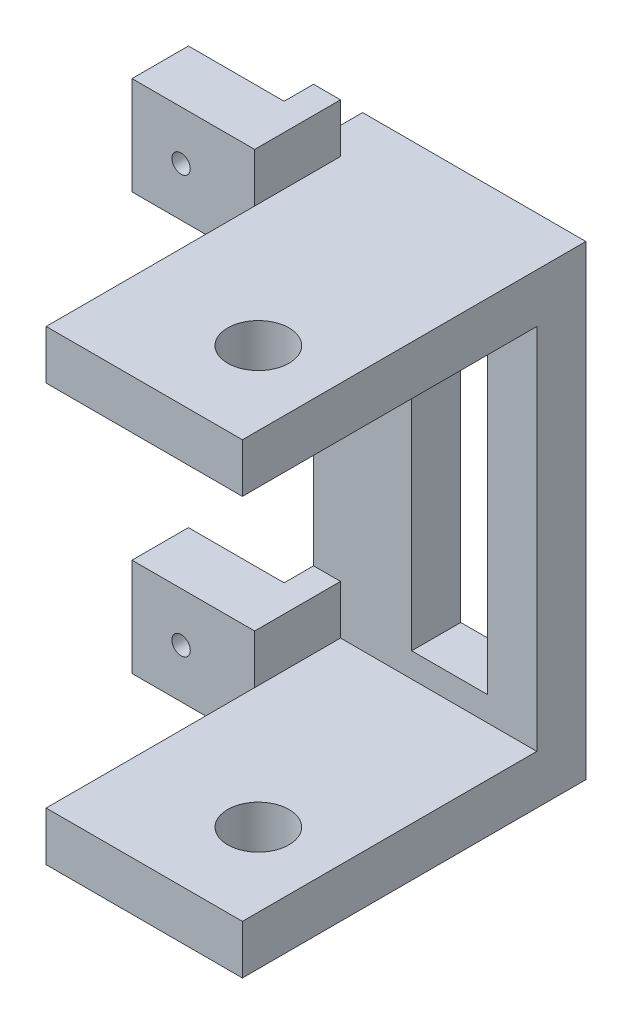
from build123d import *

# Parameters (mm, degrees)
SKETCH_2_W          = 12
SKETCH_2_H          = 19
SKETCH_2_W_2        = 3.1
SKETCH_2_H_2        = 13
EXTRUDE_1_DEPTH     = 2
SKETCH_3_W          = 8
SKETCH_3_H          = 2
EXTRUDE_2_DEPTH     = 12
SKETCH_10_W         = 5
SKETCH_10_H         = 4
EXTRUDE_4_DEPTH     = 3.5
CUT_EXTRUDE_2_REACH = 23.496
CUT_EXTRUDE_START   = 3.5
SKETCH_9_R          = 0.375
SKETCH_11_R         = 1.25
CUT_EXTRUDE_3_DEPTH = 27.165053029
CUT_EXTRUDE_4_REACH = 28.165
SKETCH_12_W         = 3.9
SKETCH_12_H         = 3.2


with BuildPart() as part:
    # 草图2 → 凸台-拉伸1 (new body)
    with BuildSketch(Plane.XY):
        with Locations((0.1, 0)):
            Rectangle(SKETCH_2_W, SKETCH_2_H)
        with Locations((2.55, 0)):
            Rectangle(SKETCH_2_W_2, SKETCH_2_H_2, mode=Mode.SUBTRACT)
    extrude(amount=EXTRUDE_1_DEPTH)

    # 草图3 → 凸台-拉伸2 (add)
    with BuildSketch(Plane.XY.offset(2)):
        with Locations((2.1, 8.5)):
            Rectangle(SKETCH_3_W, SKETCH_3_H)
        with Locations((2.1, -8.5)):
            Rectangle(SKETCH_3_W, SKETCH_3_H)
    extrude(amount=EXTRUDE_2_DEPTH)

    # 草图10 → 凸台-拉伸4 (add)
    with BuildSketch(Plane.XY.offset(2)):
        with Locations((-4.4, 9.5)):
            Rectangle(SKETCH_10_W, SKETCH_10_H)
        with Locations((-4.4, -7.5)):
            Rectangle(SKETCH_10_W, SKETCH_10_H)
    extrude(amount=EXTRUDE_4_DEPTH)

    # 草图9 → 切除-拉伸2 (cut, up to next)
    with BuildSketch(Plane.XY.offset(2).offset(CUT_EXTRUDE_START), mode=Mode.PRIVATE) as cut_extrude_2_sk1:
        with Locations((-4.9, 9.5)):
            Circle(SKETCH_9_R)
    cut_extrude_2_tool1 = extrude(cut_extrude_2_sk1.sketch, amount=-CUT_EXTRUDE_2_REACH, mode=Mode.PRIVATE) & part.part
    # 草图9 → 切除-拉伸2 (cut, up to next)
    with BuildSketch(Plane.XY.offset(2).offset(CUT_EXTRUDE_START), mode=Mode.PRIVATE) as cut_extrude_2_sk2:
        with Locations((-4.9, -7.5)):
            Circle(SKETCH_9_R)
    cut_extrude_2_tool2 = extrude(cut_extrude_2_sk2.sketch, amount=-CUT_EXTRUDE_2_REACH, mode=Mode.PRIVATE) & part.part
    add(cut_extrude_2_tool1.solids().sort_by_distance((-4.9, 9.5, 5.5))[0], mode=Mode.SUBTRACT)
    add(cut_extrude_2_tool2.solids().sort_by_distance((-4.9, -7.5, 5.5))[0], mode=Mode.SUBTRACT)

    # 草图11 → 切除-拉伸3 (cut, through all)
    with BuildSketch(Plane.XZ.offset(9.5)):
        with Locations((3.1, 10.35)):
            Circle(SKETCH_11_R)
    extrude(amount=-CUT_EXTRUDE_3_DEPTH, mode=Mode.SUBTRACT)

    # 草图12 → 切除-拉伸4 (cut, up to next)
    with BuildSketch(Plane.XZ.offset(9.5), mode=Mode.PRIVATE) as cut_extrude_4_sk1:
        with Locations((-4.95, 1.6)):
            Rectangle(SKETCH_12_W, SKETCH_12_H)
    cut_extrude_4_tool1 = extrude(cut_extrude_4_sk1.sketch, amount=-CUT_EXTRUDE_4_REACH, mode=Mode.PRIVATE) & part.part
    add(cut_extrude_4_tool1.solids().sort_by_distance((-4.95, -9.5, 1.6))[0], mode=Mode.SUBTRACT)


solid = part.part
